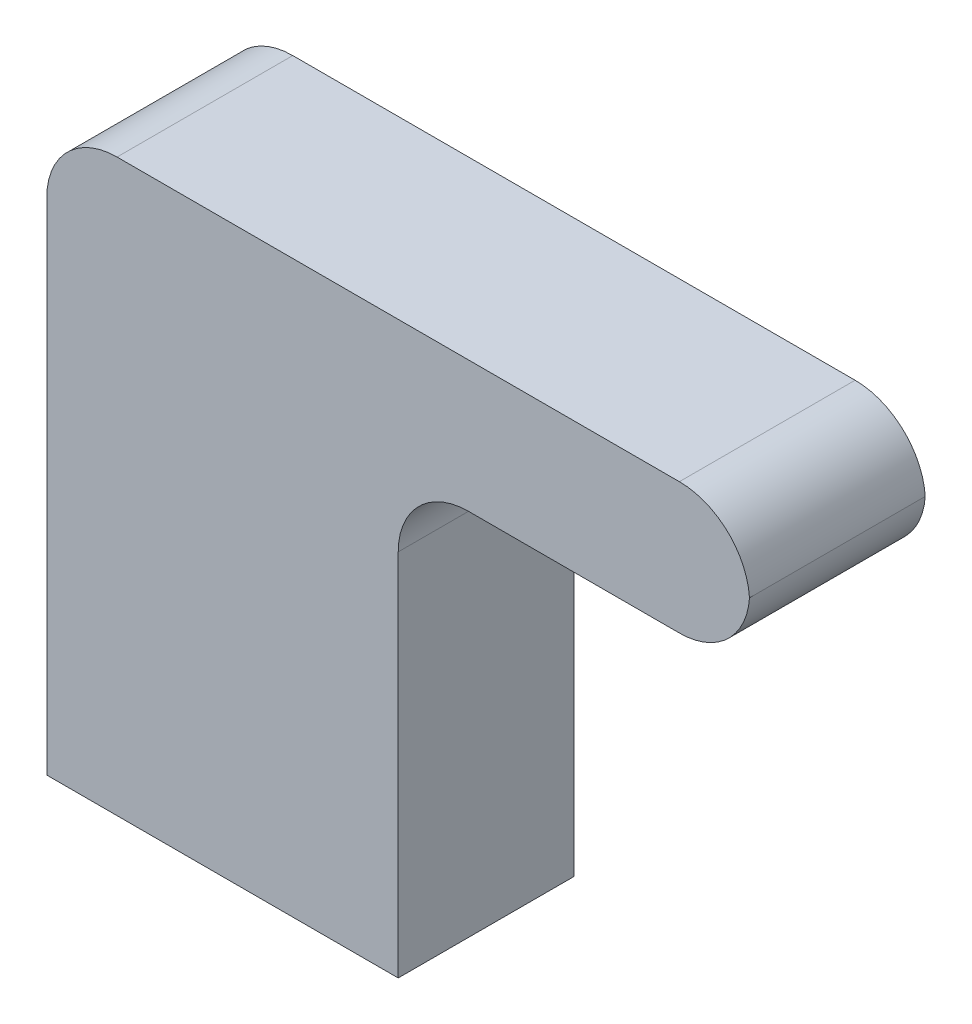
from build123d import *

# Parameters (mm, degrees)
BOSS_EXTRUDE1_DEPTH = 6.35
FILLET1_R           = 2.54


with BuildPart() as part:
    # Sketch1 → Boss-Extrude1 (new body)
    with BuildSketch(Plane.XY):
        Polygon((0, 0), (0, 15.875), (12.7, 15.875), (12.7, 20.6121), (-12.7, 20.6121), (-12.7, 0), align=None)
    extrude(amount=BOSS_EXTRUDE1_DEPTH)

    # Fillet1
    # the kernel refuses this fillet: 2.54 mm, written as the material it adds along each edge
    with BuildSketch(Plane(origin=(0, 15.875, 0), x_dir=(0, -1, 0), z_dir=(0, 0, 1))) as fillet1_piece_1:
        with BuildLine():
            CenterArc((FILLET1_R, FILLET1_R), FILLET1_R, 180, 90)
            Line((0, FILLET1_R), (0, 0))
            Line((0, 0), (FILLET1_R, 0))
        make_face()
    extrude(amount=6.35)
    # the kernel refuses this fillet: 2.54 mm, written as the material it takes off along each edge
    with BuildSketch(Plane(origin=(12.7, 15.875, -6.35), x_dir=(-1, 0, 0), z_dir=(0, 0, 1)), Plane(origin=(12.7, 20.6121, -6.35), x_dir=(0, -1, 0), z_dir=(0, 0, 1)), Plane(origin=(-12.7, 20.6121, -6.35), x_dir=(1, 0, 0), z_dir=(0, 0, 1))) as fillet1_2_piece_1:
        with BuildLine():
            CenterArc((FILLET1_R, -FILLET1_R), FILLET1_R, 90, 90)
            Line((0, -FILLET1_R), (0, 0))
            Line((0, 0), (FILLET1_R, 0))
        make_face()
    extrude(amount=19.05, mode=Mode.SUBTRACT)


solid = part.part
